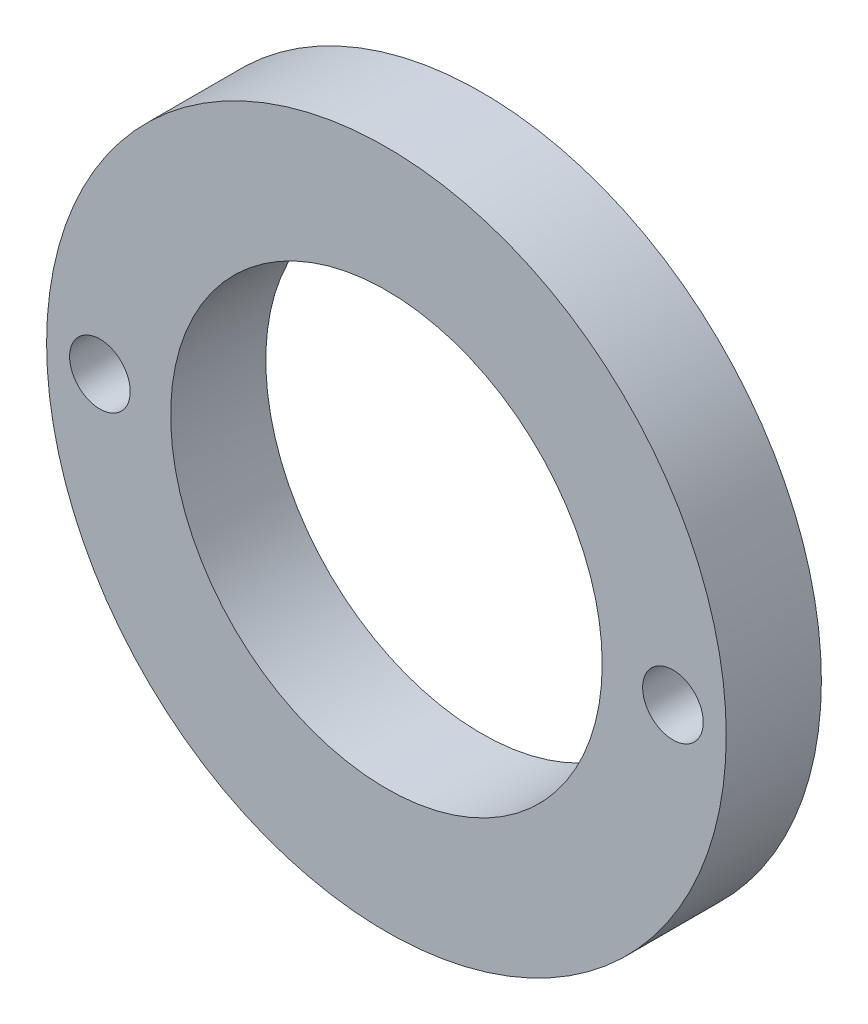
from build123d import *

# Parameters (mm, degrees)
SKETCH1_R                    = 20
SKETCH1_R_2                  = 12.7
BOSS_EXTRUDE1_DEPTH          = 5.6
F_28_0_1405_DIAMETER_HOLE1_D = 3.5687


with BuildPart() as part:
    # Sketch1 → Boss-Extrude1 (new body)
    with BuildSketch(Plane.XY):
        Circle(SKETCH1_R)
        Circle(SKETCH1_R_2, mode=Mode.SUBTRACT)
    extrude(amount=BOSS_EXTRUDE1_DEPTH)

    # #28 (0.1405) Diameter Hole1 (through all)
    with Locations(Plane.XY.offset(5.6)):
        with Locations((-16.862709614, 0), (16.862709614, 0)):
            Hole(F_28_0_1405_DIAMETER_HOLE1_D / 2)


solid = part.part
